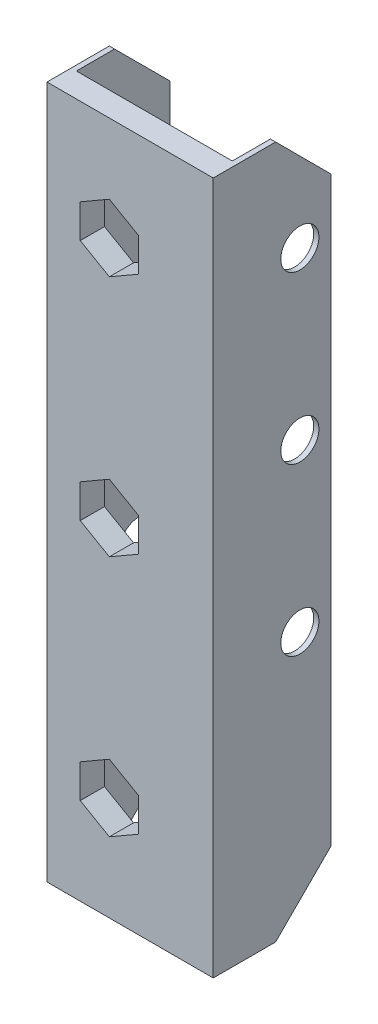
from build123d import *

# Parameters (mm, degrees)
BOSS_EXTRUDE1_DEPTH     = 100
CUT_EXTRUDE1_DEPTH      = 105.235310716
CUT_EXTRUDE1_DEPTH_BACK = 105.235310716
M5_CLEARANCE_HOLE1_D    = 5.5
CHAMFER1_SIZE           = 8


with BuildPart() as part:
    # Sketch1 → Boss-Extrude1 (new body)
    with BuildSketch(Plane(origin=(0, 0, 0), x_dir=(1, 0, 0), z_dir=(0, 1, 0))):
        Polygon((0, 0), (0, 17), (0.75, 17), (0.75, 3.5), (23.25, 3.5), (23.25, 17), (24, 17), (24, 0), align=None)
    extrude(amount=BOSS_EXTRUDE1_DEPTH)

    # Sketch2 → Cut-Extrude1 (cut, two sides: drawn at the far end of the back side and taken through both)
    with BuildSketch(Plane.XY.offset(-CUT_EXTRUDE1_DEPTH_BACK)):
        Polygon((4.8, 82.575128869), (9, 80.150257739), (13.2, 82.575128869), (13.2, 87.424871131), (9, 89.849742261), (4.8, 87.424871131), align=None)
        Polygon((4.8, 47.575128869), (9, 45.150257739), (13.2, 47.575128869), (13.2, 52.424871131), (9, 54.849742261), (4.8, 52.424871131), align=None)
        Polygon((13.2, 17.424871131), (9, 19.849742261), (4.8, 17.424871131), (4.8, 12.575128869), (9, 10.150257739), (13.2, 12.575128869), align=None)
    extrude(amount=CUT_EXTRUDE1_DEPTH + CUT_EXTRUDE1_DEPTH_BACK, mode=Mode.SUBTRACT)

    # M5 Clearance Hole1 (through all)
    with Locations(Plane(origin=(24, 0, 0), x_dir=(0, 0, -1), z_dir=(1, 0, 0))):
        with Locations((12.5, 85), (12.5, 37), (12.5, 61)):
            Hole(M5_CLEARANCE_HOLE1_D / 2)

    # Chamfer1
    chamfer1_edges = [part.edges().sort_by_distance(p)[0] for p in [
        (0.375, 100, -17),
        (23.625, 100, -17),
        (23.625, 0, -17),
        (0.375, 0, -17),
    ]]
    chamfer(chamfer1_edges, length=CHAMFER1_SIZE)


solid = part.part
